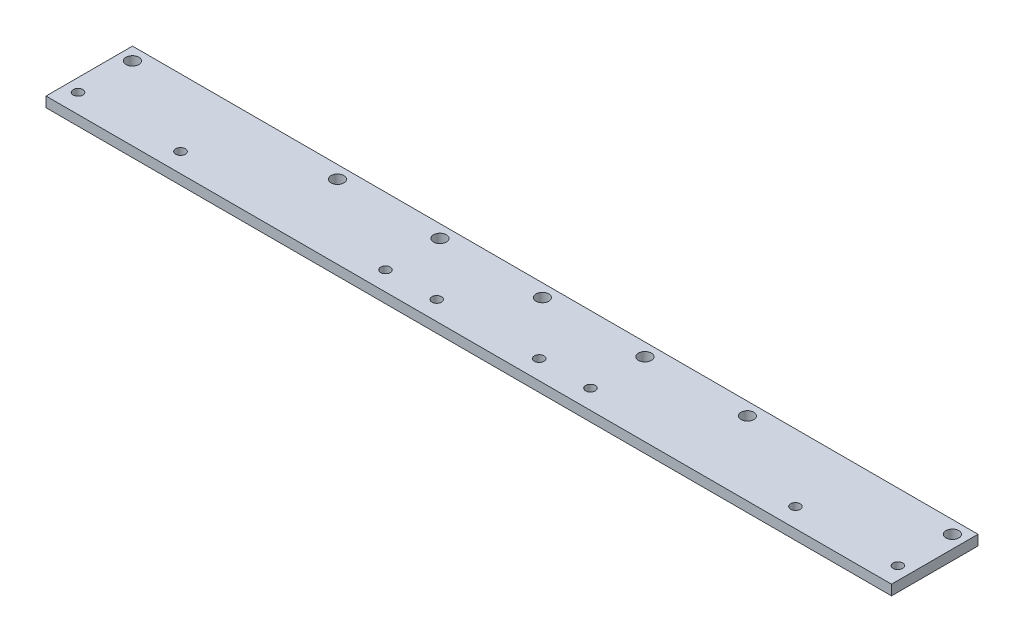
from build123d import *

# Parameters (mm, degrees)
SKETCH1_R           = 2
SKETCH1_R_2         = 1.5
BOSS_EXTRUDE1_DEPTH = 3.175
SKETCH2_R           = 1.5
CUT_EXTRUDE1_DEPTH  = 10


with BuildPart() as part:
    # Sketch1 → Boss-Extrude1 (new body)
    with BuildSketch(Plane(origin=(0, 0, 0), x_dir=(1, 0, 0), z_dir=(0, 1, 0))):
        Polygon((0, 25.535634143), (0, -1.464365857), (264, -1.464365857), (264, 4.535634143), (264, 25.535634143), align=None)
        with Locations((132, 21.535634143)):
            Circle(SKETCH1_R, mode=Mode.SUBTRACT)
        with Locations((100, 21.535634143)):
            Circle(SKETCH1_R, mode=Mode.SUBTRACT)
        with Locations((68, 21.535634143)):
            Circle(SKETCH1_R, mode=Mode.SUBTRACT)
        with Locations((4, 21.535634143)):
            Circle(SKETCH1_R, mode=Mode.SUBTRACT)
        with Locations((260, 21.535634143)):
            Circle(SKETCH1_R, mode=Mode.SUBTRACT)
        with Locations((196, 21.535634143)):
            Circle(SKETCH1_R, mode=Mode.SUBTRACT)
        with Locations((164, 21.535634143)):
            Circle(SKETCH1_R, mode=Mode.SUBTRACT)
        with Locations((260, 4.535634143)):
            Circle(SKETCH1_R_2, mode=Mode.SUBTRACT)
        with Locations((36, 4.535634143)):
            Circle(SKETCH1_R_2, mode=Mode.SUBTRACT)
        with Locations((228, 4.535634143)):
            Circle(SKETCH1_R_2, mode=Mode.SUBTRACT)
        with Locations((4, 4.535634143)):
            Circle(SKETCH1_R_2, mode=Mode.SUBTRACT)
    extrude(amount=BOSS_EXTRUDE1_DEPTH)

    # Sketch2 → Cut-Extrude1 (cut)
    with BuildSketch(Plane(origin=(0, 3.175, 0), x_dir=(1, 0, 0), z_dir=(0, 1, 0))):
        with Locations((116, 4.535634143)):
            Circle(SKETCH2_R)
        with Locations((148, 4.535634143)):
            Circle(SKETCH2_R)
        with Locations((100, 4.535634143)):
            Circle(SKETCH2_R)
        with Locations((164, 4.535634143)):
            Circle(SKETCH2_R)
    extrude(amount=-CUT_EXTRUDE1_DEPTH, mode=Mode.SUBTRACT)


solid = part.part
